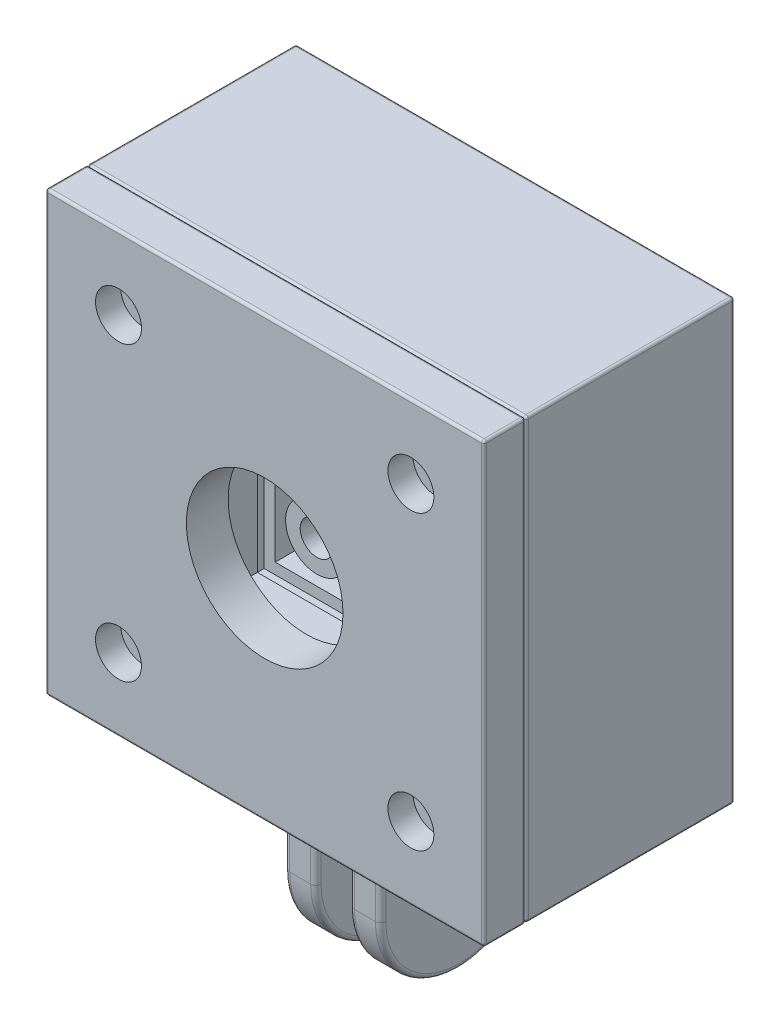
from build123d import *

# Parameters (mm, degrees)
SKIZZE1_W                                    = 42
SKIZZE1_H                                    = 42
AUFSATZ_LINEAR_AUSTRAGEN1_DEPTH              = 2.5
SKIZZE2_W                                    = 42
SKIZZE2_H                                    = 42
SKIZZE2_W_2                                  = 38.1
SKIZZE2_H_2                                  = 38.1
AUFSATZ_LINEAR_AUSTRAGEN2_DEPTH              = 17.5
SKIZZE3_R                                    = 3
AUFSATZ_LINEAR_AUSTRAGEN3_DEPTH              = 2.5
F_3_2_3_2_DURCHMESSER_BOHRUNG1_D             = 3.2
SKIZZE6_W                                    = 10
SKIZZE6_H                                    = 5
SCHNITT_LINEAR_AUSTRAGEN1_DEPTH              = 2.5
SKIZZE7_W                                    = 38.1
SKIZZE7_H                                    = 38.1
SKIZZE7_W_2                                  = 36
SKIZZE7_H_2                                  = 36
AUFSATZ_LINEAR_AUSTRAGEN4_DEPTH              = 2.5
VERRUNDUNG1_R                                = 0.25
SKIZZE8_W                                    = 42
SKIZZE8_H                                    = 42
SKIZZE8_R                                    = 7.5
AUFSATZ_LINEAR_AUSTRAGEN5_DEPTH              = 4
STIRNSENKUNG_F_R_M2_ZYLINDERSCHRAUBE_2_COUNT = 2
STIRNSENKUNG_F_R_M2_ZYLINDERSCHRAUBE_2_PITCH = 28
STIRNSENKUNG_F_R_M2_ZYLINDERSCHRAUBE_3_COUNT = 2
STIRNSENKUNG_F_R_M2_ZYLINDERSCHRAUBE_3_PITCH = 28
STIRNSENKUNG_F_R_M2_ZYLINDERSCHRAUBE_4_COUNT = 2
STIRNSENKUNG_F_R_M2_ZYLINDERSCHRAUBE_4_PITCH = 39.597979746
SKIZZE11_W                                   = 38.1
SKIZZE11_H                                   = 38.1
SKIZZE11_W_2                                 = 36
SKIZZE11_H_2                                 = 36
AUFSATZ_LINEAR_AUSTRAGEN6_DEPTH              = 13.3
VERRUNDUNG2_R                                = 0.25
SKIZZE12_W                                   = 3
SKIZZE12_H                                   = 15
AUFSATZ_LINEAR_AUSTRAGEN7_DEPTH              = 17
VERRUNDUNG3_R                                = 7.5
SKIZZE13_R                                   = 2.75
SCHNITT_LINEAR_AUSTRAGEN2_DEPTH              = 52.723882298
VERRUNDUNG4_R                                = 2
VERRUNDUNG5_R                                = 1.5
VERRUNDUNG6_R                                = 0.5


with BuildPart() as part:
    # Skizze1 → Aufsatz-Linear austragen1 (new body)
    with BuildSketch(Plane.XY):
        Rectangle(SKIZZE1_W, SKIZZE1_H)
    extrude(amount=AUFSATZ_LINEAR_AUSTRAGEN1_DEPTH)

    # Skizze2 → Aufsatz-Linear austragen2 (add)
    with BuildSketch(Plane.XY.offset(2.5)):
        Rectangle(SKIZZE2_W, SKIZZE2_H)
        Rectangle(SKIZZE2_W_2, SKIZZE2_H_2, mode=Mode.SUBTRACT)
    extrude(amount=AUFSATZ_LINEAR_AUSTRAGEN2_DEPTH)

    # Skizze3 → Aufsatz-Linear austragen3 (add)
    with BuildSketch(Plane.XY.offset(2.5)):
        with Locations((-14, 14)):
            Circle(SKIZZE3_R)
        with Locations((14, 14)):
            Circle(SKIZZE3_R)
        with Locations((-14, -14)):
            Circle(SKIZZE3_R)
        with Locations((14, -14)):
            Circle(SKIZZE3_R)
    extrude(amount=AUFSATZ_LINEAR_AUSTRAGEN3_DEPTH)

    # Ø3.2 (3.2) Durchmesser Bohrung1 (through all)
    with Locations(Plane.XY.offset(5)):
        with Locations((-14, 14), (14, 14), (-14, -14), (14, -14)):
            Hole(F_3_2_3_2_DURCHMESSER_BOHRUNG1_D / 2)

    # Skizze6 → Schnitt-Linear austragen1 (cut)
    with BuildSketch(Plane.XY.offset(2.5)):
        with Locations((5.07, -12.665)):
            Rectangle(SKIZZE6_W, SKIZZE6_H)
    extrude(amount=-SCHNITT_LINEAR_AUSTRAGEN1_DEPTH, mode=Mode.SUBTRACT)

    # Skizze7 → Aufsatz-Linear austragen4 (add)
    with BuildSketch(Plane.XY.offset(2.5)):
        Rectangle(SKIZZE7_W, SKIZZE7_H)
        Rectangle(SKIZZE7_W_2, SKIZZE7_H_2, mode=Mode.SUBTRACT)
    extrude(amount=AUFSATZ_LINEAR_AUSTRAGEN4_DEPTH)

    # Verrundung1
    verrundung1_edges = [part.edges().sort_by_distance(p)[0] for p in [
        (0, -18, 2.5),
        (18, 0, 2.5),
        (0, 18, 2.5),
        (-18, 0, 2.5),
        (21, 0, 20),
        (0, 21, 20),
        (-21, 0, 20),
        (0, -21, 20),
        (11, 14, 2.5),
        (-17, -14, 2.5),
        (11, -14, 2.5),
        (-17, 14, 2.5),
        (-21, 0, 0),
        (0, -21, 0),
        (21, 0, 0),
        (15.6, -14, 0),
        (0, 21, 0),
        (-12.4, -14, 0),
        (15.6, 14, 0),
        (-12.4, 14, 0),
        (-21, 21, 10),
        (-21, -21, 10),
        (21, -21, 10),
        (5.07, -10.165, 0),
        (21, 21, 10),
        (10.07, -12.665, 0),
        (5.07, -15.165, 0),
        (0.07, -12.665, 0),
        (5.07, -10.165, 2.5),
        (0.07, -12.665, 2.5),
        (5.07, -15.165, 2.5),
        (10.07, -12.665, 2.5),
    ]]
    fillet(verrundung1_edges, radius=VERRUNDUNG1_R)



with BuildPart() as body_2:
    # Skizze8 → Aufsatz-Linear austragen5 (new body)
    with BuildSketch(Plane.XY.offset(20)):
        Rectangle(SKIZZE8_W, SKIZZE8_H)
        Circle(SKIZZE8_R, mode=Mode.SUBTRACT)
    extrude(amount=AUFSATZ_LINEAR_AUSTRAGEN5_DEPTH)

    # Skizze10 → Stirnsenkung für M2 Zylinderschraube mit Innensechskant1 (revolve, cut)
    with BuildSketch(Plane(origin=(-14, 14, 24), x_dir=(0, -1, 0), z_dir=(1, 0, 0))):
        Polygon((0, 0), (0, 10.721032743), (1.2, 10), (1.2, 2.4), (2.2, 2.4), (2.2, 0), align=None)
    stirnsenkung_f_r_m2_zylinderschraube_mit = revolve(axis=Axis((-14, 14, 30.35), (0, 0, -1)), mode=Mode.SUBTRACT)

    # Stirnsenkung f_r M2 Zylinderschraube 2: Stirnsenkung für M2 Zylinderschraube mit Innensechskant1 ×2
    with Locations(*[(i * STIRNSENKUNG_F_R_M2_ZYLINDERSCHRAUBE_2_PITCH, 0, 0) for i in range(1, STIRNSENKUNG_F_R_M2_ZYLINDERSCHRAUBE_2_COUNT)]):
        add(stirnsenkung_f_r_m2_zylinderschraube_mit, mode=Mode.SUBTRACT)

    # Stirnsenkung f_r M2 Zylinderschraube 3: Stirnsenkung für M2 Zylinderschraube mit Innensechskant1 ×2
    with Locations(*[(0, -i * STIRNSENKUNG_F_R_M2_ZYLINDERSCHRAUBE_3_PITCH, 0) for i in range(1, STIRNSENKUNG_F_R_M2_ZYLINDERSCHRAUBE_3_COUNT)]):
        add(stirnsenkung_f_r_m2_zylinderschraube_mit, mode=Mode.SUBTRACT)

    # Stirnsenkung f_r M2 Zylinderschraube 4: Stirnsenkung für M2 Zylinderschraube mit Innensechskant1 ×2
    with Locations(*[Vector(0.7071067811865477, -0.7071067811865475, 0) * (i * STIRNSENKUNG_F_R_M2_ZYLINDERSCHRAUBE_4_PITCH) for i in range(1, STIRNSENKUNG_F_R_M2_ZYLINDERSCHRAUBE_4_COUNT)]):
        add(stirnsenkung_f_r_m2_zylinderschraube_mit, mode=Mode.SUBTRACT)

    # Skizze11 → Aufsatz-Linear austragen6 (add)
    with BuildSketch(Plane(origin=(0, 0, 20), x_dir=(-1, 0, 0), z_dir=(0, 0, -1))):
        Rectangle(SKIZZE11_W, SKIZZE11_H)
        Rectangle(SKIZZE11_W_2, SKIZZE11_H_2, mode=Mode.SUBTRACT)
    extrude(amount=AUFSATZ_LINEAR_AUSTRAGEN6_DEPTH)

    # Verrundung2
    verrundung2_edges = [body_2.edges().sort_by_distance(p)[0] for p in [
        (21, 0, 24),
        (0, 21, 24),
        (-21, 0, 24),
        (0, 21, 20),
        (21, 0, 20),
        (0, -21, 20),
        (-21, 0, 20),
        (-21, 21, 22),
        (21, 21, 22),
        (21, -21, 22),
        (-21, -21, 22),
        (0, -21, 24),
    ]]
    fillet(verrundung2_edges, radius=VERRUNDUNG2_R)


with BuildPart() as part_1:
    add(part.part)

    add(body_2.part)  # Aufsatz-Linear austragen7 merges body 2
    # Skizze12 → Aufsatz-Linear austragen7 (add)
    with BuildSketch(Plane.XZ.offset(21)):
        with Locations((-3.1, 10)):
            Rectangle(SKIZZE12_W, SKIZZE12_H)
        with Locations((3.1, 10)):
            Rectangle(SKIZZE12_W, SKIZZE12_H)
    extrude(amount=AUFSATZ_LINEAR_AUSTRAGEN7_DEPTH)

    # Verrundung3
    verrundung3_edges = [part_1.edges().sort_by_distance(p)[0] for p in [
        (3.1, -38, 17.5),
        (3.1, -38, 2.5),
        (-3.1, -38, 2.5),
        (-3.1, -38, 17.5),
    ]]
    fillet(verrundung3_edges, radius=VERRUNDUNG3_R - 0.0001)  # a hair under: the kernel refuses the full size

    # Skizze13 → Schnitt-Linear austragen2 (cut, through all)
    with BuildSketch(Plane.ZY.offset(4.6)):
        with Locations((10, -30.5)):
            Circle(SKIZZE13_R)
    extrude(amount=-SCHNITT_LINEAR_AUSTRAGEN2_DEPTH, mode=Mode.SUBTRACT)

    # Verrundung4
    verrundung4_edges = [part_1.edges().sort_by_distance(p)[0] for p in [
        (-4.6, -21, 10),
        (-3.1, -21, 2.5),
        (-3.1, -21, 17.5),
        (3.1, -21, 2.5),
        (4.6, -21, 10),
        (3.1, -21, 17.5),
    ]]
    fillet(verrundung4_edges, radius=VERRUNDUNG4_R)

    # Verrundung5
    verrundung5_edges = [part_1.edges().sort_by_distance(p)[0] for p in [
        (-1.6, -21, 10),
        (1.6, -21, 10),
    ]]
    fillet(verrundung5_edges, radius=VERRUNDUNG5_R)

    # Verrundung6
    verrundung6_edges = [part_1.edges().sort_by_distance(p)[0] for p in [
        (1.6, -26.75005, 2.5),
        (1.6, -26.75005, 17.5),
        (1.6, -35.803330148, 4.696669852),
        (1.6, -35.803330148, 15.303330148),
        (4.6, -26.75005, 17.5),
        (4.6, -26.75005, 2.5),
        (4.6, -35.803330148, 4.696669852),
        (4.6, -35.803330148, 15.303330148),
        (-1.6, -26.75005, 17.5),
        (-1.6, -26.75005, 2.5),
        (-1.6, -35.803330148, 15.303330148),
        (-1.6, -35.803330148, 4.696669852),
        (-4.6, -26.75005, 2.5),
        (-4.6, -26.75005, 17.5),
        (-4.6, -35.803330148, 15.303330148),
        (-4.6, -35.803330148, 4.696669852),
        (1.6, -22.747991415, 17.515940607),
        (-1.6, -22.747991415, 2.484059393),
        (5.307902185, -21.473407966, 1.792097815),
        (5.307902185, -21.473407966, 18.207902185),
        (-5.307902185, -21.473407966, 18.207902185),
        (-5.307902185, -21.473407966, 1.792097815),
        (1.6, -22.747991415, 2.484059393),
        (-1.6, -22.747991415, 17.515940607),
        (1.067090538, -21.353380677, 1.635184912),
        (1.067090539, -21.353380676, 18.364815088),
        (-1.067090541, -21.353380672, 18.364815087),
        (-1.067090539, -21.353380676, 1.635184912),
    ]]
    fillet(verrundung6_edges, radius=VERRUNDUNG6_R)


solid = part_1.part
